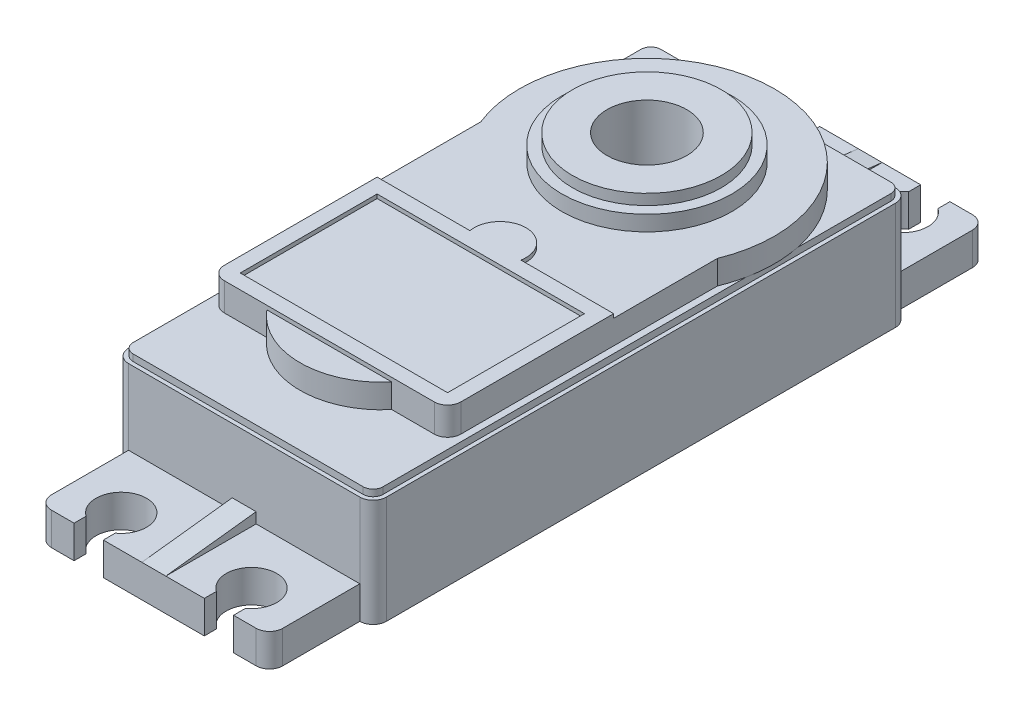
from build123d import *

# Parameters (mm, degrees)
BASES_W                              = 19.4
BASES_H                              = 40.3
BASE_DEPTH                           = 8.6
SHAFTHOLES_R                         = 3
SHAFT_HOLE_DEPTH                     = 24.959810099
MOUNTINGTABS_W                       = 17.4
MOUNTINGTABS_H                       = 2.45
MOUNTING_TAB_DEPTH                   = 6.8
MOUNTING_HOLE_DEPTH                  = 30.295306791
BOTTOMALIGNHOLES_R                   = 0.7
BOTTOM_ALIGN_HOLE_DEPTH              = 0.5
TRIANGULAR_TAB_DEPTH                 = 0.9
MOUNTING_TAB_FEATURES_M_COPY_1_DEPTH = 30.295306791
BASE_START                           = 1.8
BASETOPBODYS_R                       = 3
BASE_TOP_BODY_DEPTH                  = 1.8
PART_CIRCLE_DEPTH                    = 1.8
TOP_START                            = 1.15
TOPBODYCYLINDER1_R                   = 6.4
TOPBODYCYLINDER1_R_2                 = 3
TOP_BODY_CYLINDER_1_DEPTH            = 1.15
TOB_START                            = 0.8
TOPBODYCYLINDER2_R                   = 5.6
TOPBODYCYLINDER2_R_2                 = 3
TOB_BODY_CYLINDER_2_DEPTH            = 0.8
TOPBODYLABELNEST_W                   = 17.8
TOPBODYLABELNEST_H                   = 12.5
TOPBODYLABELNEST_W_2                 = 15.6
TOPBODYLABELNEST_H_2                 = 10.3
TOP_BODY_LABEL_NEST_DEPTH            = 0.3
PART_CIRCLE_2_DEPTH                  = 0.3
BORDERCUTS_W                         = 19.4
BORDERCUTS_H                         = 40.3
BORDERCUTS_W_2                       = 18.8
BORDERCUTS_H_2                       = 39.7
BORDER_CUT_DEPTH                     = 0.5
MAIN_BODY_FEATURES_F_R               = 1
BORDER_CUT_F_R                       = 0.75


with BuildPart() as part:
    # BaseS → BASE (new body)
    with BuildSketch(Plane(origin=(0, 0, 0), x_dir=(1, 0, 0), z_dir=(0, 1, 0))):
        Rectangle(BASES_W, BASES_H)
    extrude(amount=BASE_DEPTH)

    # ShaftHoleS → SHAFT HOLE (cut, through all)
    with BuildSketch(Plane(origin=(0, 8.6, 0), x_dir=(1, 0, 0), z_dir=(0, 1, 0))):
        with Locations(Location((0, 10.15, 0), (0, 0, 270))):
            Circle(SHAFTHOLES_R)
    extrude(amount=-SHAFT_HOLE_DEPTH, mode=Mode.SUBTRACT)

    # MountingTabS → MOUNTING TAB (add)
    with BuildSketch(Plane.XY.offset(20.15)):
        with Locations((0, 1.225)):
            Rectangle(MOUNTINGTABS_W, MOUNTINGTABS_H)
    mounting_tab = extrude(amount=MOUNTING_TAB_DEPTH)

    # MountingHoleS → MOUNTING HOLE (cut, through all)
    with BuildSketch(Plane(origin=(0, 2.45, 0), x_dir=(1, 0, 0), z_dir=(0, 1, 0))):
        with BuildLine():
            Line((-6, -26.049193338), (-6, -26.95))
            Line((-6, -26.95), (-3.8, -26.95))
            Line((-3.8, -26.95), (-3.8, -26.049193338))
            ThreePointArc((-3.8, -26.049193338), (-4.9, -22.6), (-6, -26.049193338))
        make_face()
    mounting_hole = extrude(amount=-MOUNTING_HOLE_DEPTH, mode=Mode.SUBTRACT)

    # MH M: MOUNTING HOLE across plane
    add(mounting_hole.mirror(Plane(origin=(0, 0, 0), x_dir=(0, 0, 1), z_dir=(1, 0, 0))), mode=Mode.SUBTRACT)

    # BottomAlignHoleS → BOTTOM ALIGN HOLE (cut)
    with BuildSketch(Plane.XZ):
        with Locations(Location((0, 24.95, 0), (0, 0, 270))):
            Circle(BOTTOMALIGNHOLES_R)
    bottom_align_hole = extrude(amount=-BOTTOM_ALIGN_HOLE_DEPTH, mode=Mode.SUBTRACT)

    # TriangularTabS → TRIANGULAR TAB (add, symmetric)
    with BuildSketch(Plane(origin=(0, 0, 0), x_dir=(0, 0, -1), z_dir=(1, 0, 0))):
        Polygon((-20.15, 2.45), (-26.95, 2.45), (-20.15, 3.25), align=None)
    triangular_tab = extrude(amount=TRIANGULAR_TAB_DEPTH, both=True)

    # MOUNTING TAB FEATURES M: MOUNTING TAB, MOUNTING HOLE, BOTTOM ALIGN HOLE, TRIANGULAR TAB across plane
    add(mounting_tab.mirror(Plane.XY))
    add(mounting_hole.mirror(Plane.XY), mode=Mode.SUBTRACT)
    add(bottom_align_hole.mirror(Plane.XY), mode=Mode.SUBTRACT)
    add(triangular_tab.mirror(Plane.XY))

    # MOUNTING TAB FEATURES M copy 1 sketch → MOUNTING TAB FEATURES M copy 1 (cut, through all)
    with BuildSketch(Plane(origin=(0, 2.45, 0), x_dir=(-1, 0, 0), z_dir=(0, 1, 0))):
        with BuildLine():
            Line((-6, -26.049193338), (-6, -26.95))
            Line((-6, -26.95), (-3.8, -26.95))
            Line((-3.8, -26.95), (-3.8, -26.049193338))
            ThreePointArc((-3.8, -26.049193338), (-4.9, -22.6), (-6, -26.049193338))
        make_face()
    extrude(amount=-MOUNTING_TAB_FEATURES_M_COPY_1_DEPTH, mode=Mode.SUBTRACT)

    # BaseTopBodyS → BASE TOP BODY (add)
    with BuildSketch(Plane(origin=(0, 8.6, 0), x_dir=(1, 0, 0), z_dir=(0, 1, 0)).offset(BASE_START)):
        with BuildLine():
            Line((-8.9, -13.748610843), (8.9, -13.748610843))
            Line((8.9, -13.748610843), (8.9, 6.551389157))
            ThreePointArc((8.9, 6.551389157), (0, 19.75), (-8.9, 6.551389157))
            Line((-8.9, 6.551389157), (-8.9, -13.748610843))
        make_face()
        with Locations(Location((0, 10.15, 0), (0, 0, 270))):
            Circle(BASETOPBODYS_R, mode=Mode.SUBTRACT)
    extrude(amount=-BASE_TOP_BODY_DEPTH)

    # PartCircleS → PART CIRCLE (add)
    with BuildSketch(Plane(origin=(0, 8.6, 0), x_dir=(1, 0, 0), z_dir=(0, 1, 0))):
        with BuildLine():
            Line((-4.7, -13.748610843), (4.7, -13.748610843))
            ThreePointArc((4.7, -13.748610843), (0, -15.948610843), (-4.7, -13.748610843))
        make_face()
    extrude(amount=PART_CIRCLE_DEPTH)

    # TopBodyCylinder1 → TOP BODY CYLINDER 1 (add)
    with BuildSketch(Plane(origin=(0, 10.4, 0), x_dir=(1, 0, 0), z_dir=(0, 1, 0)).offset(TOP_START)):
        with Locations(Location((0, 10.15, 0), (0, 0, 270))):
            Circle(TOPBODYCYLINDER1_R)
        with Locations(Location((0, 10.15, 0), (0, 0, 270))):
            Circle(TOPBODYCYLINDER1_R_2, mode=Mode.SUBTRACT)
    extrude(amount=-TOP_BODY_CYLINDER_1_DEPTH)

    # TopBodyCylinder2 → TOB BODY CYLINDER 2 (add)
    with BuildSketch(Plane(origin=(0, 11.55, 0), x_dir=(1, 0, 0), z_dir=(0, 1, 0)).offset(TOB_START)):
        with Locations(Location((0, 10.15, 0), (0, 0, 270))):
            Circle(TOPBODYCYLINDER2_R)
        with Locations(Location((0, 10.15, 0), (0, 0, 270))):
            Circle(TOPBODYCYLINDER2_R_2, mode=Mode.SUBTRACT)
    extrude(amount=-TOB_BODY_CYLINDER_2_DEPTH)

    # TopBodyLabelNest → TOP BODY LABEL NEST (add)
    with BuildSketch(Plane(origin=(0, 10.4, 0), x_dir=(1, 0, 0), z_dir=(0, 1, 0))):
        with Locations((0, -7.498610843)):
            Rectangle(TOPBODYLABELNEST_W, TOPBODYLABELNEST_H)
        with Locations((0, -7.498610843)):
            Rectangle(TOPBODYLABELNEST_W_2, TOPBODYLABELNEST_H_2, mode=Mode.SUBTRACT)
    extrude(amount=TOP_BODY_LABEL_NEST_DEPTH)

    # PartCircle2S → PART CIRCLE 2 (add)
    with BuildSketch(Plane(origin=(0, 10.4, 0), x_dir=(1, 0, 0), z_dir=(0, 1, 0))):
        with BuildLine():
            Line((1.303840481, -2.348610843), (-1.303840481, -2.348610843))
            ThreePointArc((-1.303840481, -2.348610843), (0, 1.051389157), (1.303840481, -2.348610843))
        make_face()
    extrude(amount=PART_CIRCLE_2_DEPTH)

    # BorderCutS → BORDER CUT (cut)
    with BuildSketch(Plane(origin=(0, 8.6, 0), x_dir=(1, 0, 0), z_dir=(0, 1, 0))):
        Rectangle(BORDERCUTS_W, BORDERCUTS_H)
        Rectangle(BORDERCUTS_W_2, BORDERCUTS_H_2, mode=Mode.SUBTRACT)
    extrude(amount=-BORDER_CUT_DEPTH, mode=Mode.SUBTRACT)

    # MAIN BODY FEATURES F
    main_body_features_f_edges = [part.edges().sort_by_distance(p)[0] for p in [
        (8.7, 1.225, -26.95),
        (-8.7, 1.225, -26.95),
        (-9.7, 4.05, -20.15),
        (9.7, 4.05, -20.15),
        (-8.9, 9.65, 13.748610843),
        (8.9, 9.65, 13.748610843),
        (-9.7, 4.05, 20.15),
        (9.7, 4.05, 20.15),
        (8.7, 1.225, 26.95),
        (-8.7, 1.225, 26.95),
    ]]
    fillet(main_body_features_f_edges, radius=MAIN_BODY_FEATURES_F_R - 0.0001)  # a hair under: the kernel refuses the full size

    # BORDER CUT F
    border_cut_f_edges = [part.edges().sort_by_distance(p)[0] for p in [
        (9.4, 8.35, -19.85),
        (9.4, 8.35, 19.85),
        (-9.4, 8.35, 19.85),
        (-9.4, 8.35, -19.85),
    ]]
    fillet(border_cut_f_edges, radius=BORDER_CUT_F_R)


solid = part.part
